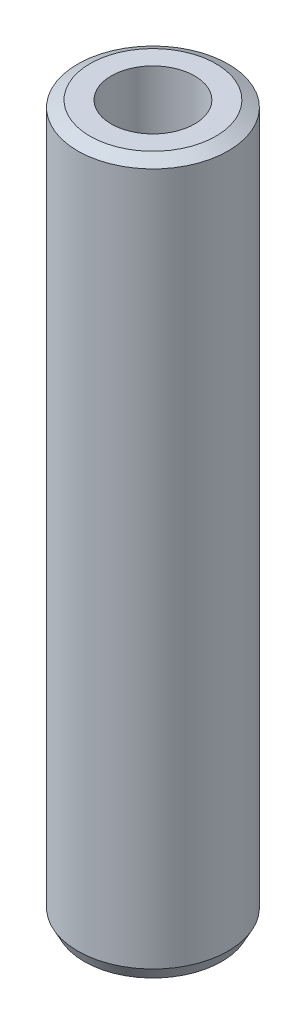
from build123d import *
from OCP.BRepFilletAPI import BRepFilletAPI_MakeChamfer

# Parameters (mm, degrees)
SKETCH1_R           = 57.5
BOSS_EXTRUDE1_DEPTH = 543.585864412
SKETCH2_R           = 31.841723843
CUT_EXTRUDE1_DEPTH  = 550.63450764
CHAMFER1_SIZE       = 4.986803746
CHAMFER1_SIZE2      = 9.46466921


with BuildPart() as part:
    # Sketch1 → Boss-Extrude1 (new body)
    with BuildSketch(Plane(origin=(0, 0, 0), x_dir=(1, 0, 0), z_dir=(0, 1, 0))):
        Circle(SKETCH1_R)
    extrude(amount=BOSS_EXTRUDE1_DEPTH)

    # Sketch2 → Cut-Extrude1 (cut, through all)
    with BuildSketch(Plane(origin=(0, 0, 0), x_dir=(1, 0, 0), z_dir=(0, 1, 0))):
        Circle(SKETCH2_R)
    extrude(amount=CUT_EXTRUDE1_DEPTH, mode=Mode.SUBTRACT)

    # Chamfer1: one chamfer whose edges measure the first distance from different faces: ONE call of the kernel's chamfer builder (chamfer() names one face for all edges)
    chamfer1_edges_1 = [part.edges().sort_by_distance(p)[0] for p in [
        (-57.5, 543.585864412, 0),
    ]]
    chamfer1_side_1 = [part.faces().sort_by_distance(p)[0] for p in [
        (-57.5, 271.792932206, 0),
    ]]
    chamfer1_edges_2 = [part.edges().sort_by_distance(p)[0] for p in [
        (-57.5, 0, 0),
    ]]
    chamfer1_side_2 = [part.faces().sort_by_distance(p)[0] for p in [
        (-55.873654403, 0, 0),
    ]]
    chamfer1 = BRepFilletAPI_MakeChamfer(part.part.solid().wrapped)
    for e in chamfer1_edges_1:
        chamfer1.Add(CHAMFER1_SIZE, CHAMFER1_SIZE2, e.wrapped, chamfer1_side_1[0].wrapped)  # the first distance lies on this face
    for e in chamfer1_edges_2:
        chamfer1.Add(CHAMFER1_SIZE, CHAMFER1_SIZE2, e.wrapped, chamfer1_side_2[0].wrapped)  # the first distance lies on this face
    add(Compound.cast(chamfer1.Shape()), mode=Mode.REPLACE)


solid = part.part
